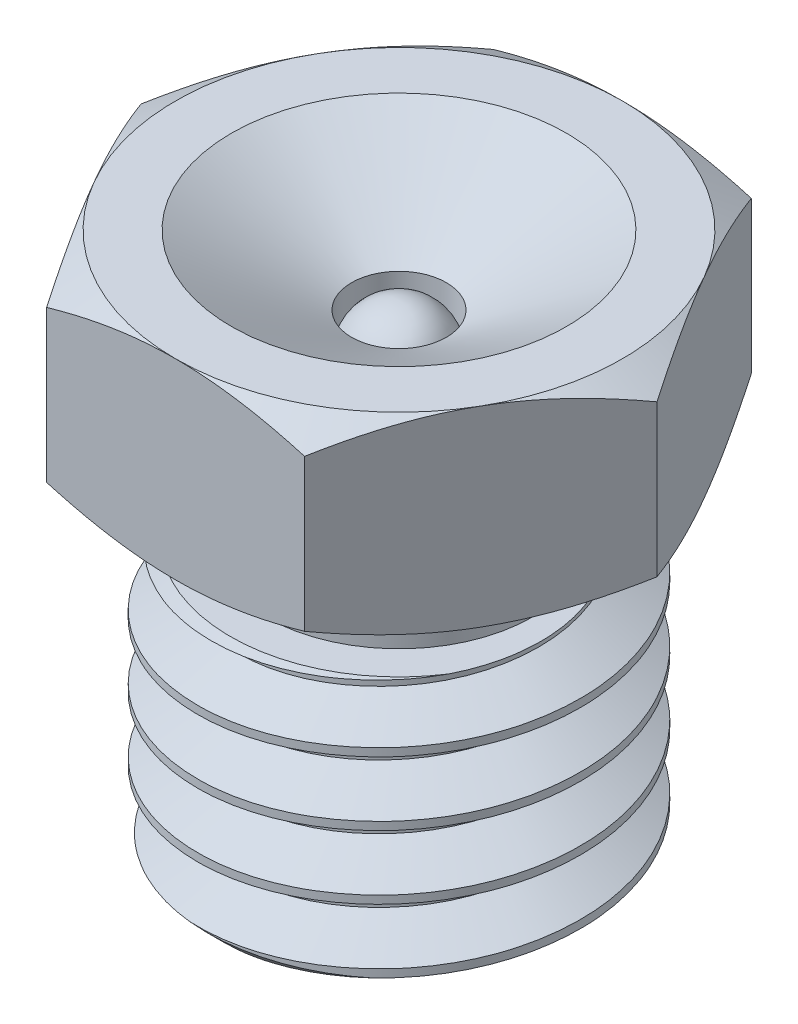
from build123d import *

# Parameters (mm, degrees)
CHAMFER1_SIZE       = 0.36
FILLET1_R           = 0.231
CUT_SWEEP1_PITCH    = 1
BOSS_EXTRUDE1_DEPTH = 3
SKETCH6_OUTSIDE_W   = 21.676
SKETCH6_OUTSIDE_H   = 20.594
SKETCH6_OUTSIDE_R   = 3.5
CUT_EXTRUDE1_DEPTH  = 2.54
CUT_EXTRUDE1_DRAFT  = -60
SKETCH7_OUTSIDE_W   = 21.676
SKETCH7_OUTSIDE_H   = 20.594
SKETCH7_OUTSIDE_R   = 3.5
CUT_EXTRUDE2_DEPTH  = 2.54
CUT_EXTRUDE2_DRAFT  = -60
SKETCH11_R          = 2.1
BOSS_EXTRUDE2_DEPTH = 1.2
SKETCH9_R           = 0.7425
CUT_EXTRUDE4_DEPTH  = 11.468205832


with BuildPart() as part:
    # Sketch2 → Revolve1 (revolve)
    with BuildSketch(Plane.XY, mode=Mode.PRIVATE) as revolve1_sk:
        Polygon((0, 0), (0, -6), (1.65, -6), (1.65, -5.4), (3, -5.4), (3, -1.2), (2.1, -1.2), (2.1, 0), align=None)
    revolve(revolve1_sk.sketch.rotate(Axis((0, 3, 0), (0, -1, 0)), 180), axis=Axis((0, 3, 0), (0, -1, 0)))

    # Chamfer1
    chamfer1_edges = [part.edges().sort_by_distance(p)[0] for p in [
        (3, -5.4, 0),
        (3, -1.2, 0),
    ]]
    chamfer(chamfer1_edges, length=CHAMFER1_SIZE)

    # Fillet1
    fillet1_edges = [part.edges().sort_by_distance(p)[0] for p in [
        (1.65, -6, 0),
        (1.65, -5.4, 0),
    ]]
    fillet(fillet1_edges, radius=FILLET1_R)

    # Cut-Sweep1: the profile of Sketch4 profile screwed along a right-hand helix of 5.2 turns, 8 arcs to a turn; built about Z, then put on its axis
    cut_sweep1_z = Axis((0, 0, 0), (0, 0, 1))
    cut_sweep1_corners = [(3.0003, 0, 0.000173205), (3.0003, 0, -0.875173205), (2.350480947, 0, -0.5), (2.350480947, 0, -0.375)]
    with BuildLine(mode=Mode.PRIVATE) as cut_sweep1_profile:
        Line(cut_sweep1_corners[0], cut_sweep1_corners[1])
        Line(cut_sweep1_corners[1], cut_sweep1_corners[2])
        Line(cut_sweep1_corners[2], cut_sweep1_corners[3])
        Line(cut_sweep1_corners[3], cut_sweep1_corners[0])
    cut_sweep1_cap = Face(cut_sweep1_profile.wire())
    cut_sweep1_turn_angles = [0, 22.5, 45, 67.5, 90, 112.5, 135, 157.5, 180, 202.5, 225, 247.5, 270, 292.5, 315, 337.5, 360]
    cut_sweep1_turn_weights = [1, 0.9238795325112867, 1, 0.9238795325112867, 1, 0.9238795325112867, 1, 0.9238795325112867, 1, 0.9238795325112867, 1, 0.9238795325112867, 1, 0.9238795325112867, 1, 0.9238795325112867, 1]
    cut_sweep1_turn_rails = [Edge.make_bspline([Vector(p[0], p[1], 0).rotate(cut_sweep1_z, cut_sweep1_turn_angles[k]) / cut_sweep1_turn_weights[k] + Vector(0, 0, p[2] + CUT_SWEEP1_PITCH * cut_sweep1_turn_angles[k] / 360) for k in range(17)], [0, 0, 0, 1, 1, 2, 2, 3, 3, 4, 4, 5, 5, 6, 6, 7, 7, 8, 8, 8], 2, cut_sweep1_turn_weights) for p in cut_sweep1_corners]
    cut_sweep1_turn_sides = [Face.make_surface_from_curves(cut_sweep1_turn_rails[p[0]], cut_sweep1_turn_rails[p[1]]) for p in [(0, 1), (1, 2), (2, 3), (3, 0)]]
    cut_sweep1_last_angles = [1800, 1822.5, 1845, 1858.5, 1872]
    cut_sweep1_last_weights = [1, 0.9238795325112867, 1, 0.9723699203976631, 1]
    cut_sweep1_last_rails = [Edge.make_bspline([Vector(p[0], p[1], 0).rotate(cut_sweep1_z, cut_sweep1_last_angles[k]) / cut_sweep1_last_weights[k] + Vector(0, 0, p[2] + CUT_SWEEP1_PITCH * cut_sweep1_last_angles[k] / 360) for k in range(5)], [0, 0, 0, 1, 1, 2, 2, 2], 2, cut_sweep1_last_weights) for p in cut_sweep1_corners]
    cut_sweep1_last_sides = [Face.make_surface_from_curves(cut_sweep1_last_rails[p[0]], cut_sweep1_last_rails[p[1]]) for p in [(0, 1), (1, 2), (2, 3), (3, 0)]]
    cut_sweep1 = Plane(origin=(0, -5.4, 0), x_dir=(-1, 0, 0), z_dir=(0, 1, 0)) * Solid(Shell([*[p.moved(Location((0, 0, CUT_SWEEP1_PITCH * i))) for i in range(5) for p in cut_sweep1_turn_sides], *cut_sweep1_last_sides, cut_sweep1_cap, cut_sweep1_cap.rotate(cut_sweep1_z, 1872).moved(Location((0, 0, CUT_SWEEP1_PITCH * 1872 / 360)))]))
    add(cut_sweep1, mode=Mode.SUBTRACT)

    # Sketch5 → Boss-Extrude1 (add)
    with BuildSketch(Plane(origin=(0, 0, 0), x_dir=(1, 0, 0), z_dir=(0, 1, 0))):
        Polygon((4.041451884, 0), (2.020725942, 3.5), (-2.020725942, 3.5), (-4.041451884, 0), (-2.020725942, -3.5), (2.020725942, -3.5), align=None)
    extrude(amount=BOSS_EXTRUDE1_DEPTH)


with BuildPart() as cut_extrude1_tool:
    # Sketch6 outside → Cut-Extrude1 (with draft: the straight prism first)
    with BuildSketch(Plane.XZ):
        Rectangle(SKETCH6_OUTSIDE_W, SKETCH6_OUTSIDE_H)
        Circle(SKETCH6_OUTSIDE_R, mode=Mode.SUBTRACT)
    extrude(amount=-CUT_EXTRUDE1_DEPTH)
    # Cut-Extrude1: the draft: its side faces are tilted about the plane it starts from
    cut_extrude1_sides = [cut_extrude1_tool.faces().sort_by_distance(p)[0] for p in [
        (0, 1.27, -10.297),
        (10.838, 1.27, 0),
        (0, 1.27, 10.297),
        (-10.838, 1.27, 0),
        (-3.5, 1.27, 0),
    ]]
    draft(cut_extrude1_sides, Plane.XZ, CUT_EXTRUDE1_DRAFT)


with BuildPart() as part_1:
    add(part.part)

    # Cut-Extrude1: cut by cut_extrude1_tool
    add(cut_extrude1_tool.part, mode=Mode.SUBTRACT)


with BuildPart() as cut_extrude2_tool:
    # Sketch7 outside → Cut-Extrude2 (with draft: the straight prism first)
    with BuildSketch(Plane(origin=(0, 3, 0), x_dir=(1, 0, 0), z_dir=(0, 1, 0))):
        Rectangle(SKETCH7_OUTSIDE_W, SKETCH7_OUTSIDE_H)
        Circle(SKETCH7_OUTSIDE_R, mode=Mode.SUBTRACT)
    extrude(amount=-CUT_EXTRUDE2_DEPTH)
    # Cut-Extrude2: the draft: its side faces are tilted about the plane it starts from
    cut_extrude2_sides = [cut_extrude2_tool.faces().sort_by_distance(p)[0] for p in [
        (0, 1.73, 10.297),
        (10.838, 1.73, 0),
        (0, 1.73, -10.297),
        (-10.838, 1.73, 0),
        (-3.5, 1.73, 0),
    ]]
    draft(cut_extrude2_sides, Plane(origin=(0, 3, 0), x_dir=(1, 0, 0), z_dir=(0, 1, 0)), CUT_EXTRUDE2_DRAFT)


with BuildPart() as part_2:
    add(part_1.part)

    # Cut-Extrude2: cut by cut_extrude2_tool
    add(cut_extrude2_tool.part, mode=Mode.SUBTRACT)

    # Sketch11 → Boss-Extrude2 (add)
    with BuildSketch(Plane.XZ):
        with Locations(Location((0, 0, 0), (0, 0, 180))):
            Circle(SKETCH11_R)
    extrude(amount=BOSS_EXTRUDE2_DEPTH)

    # Cut-Extrude3 cone 1 section (through the dimple's axis) → Cut-Extrude3 (revolve, cut)
    with BuildSketch(Plane(origin=(0, 3, 0), x_dir=(0, 0, 1), z_dir=(1, 0, 0))):
        Polygon((0, 0), (2.625, 0), (0, 1.515544457), align=None)
    revolve(axis=Axis((0, 3, 0), (0, -1, 0)), mode=Mode.SUBTRACT)

    # Sketch9 → Cut-Extrude4 (cut, through all)
    with BuildSketch(Plane.XZ.offset(6)):
        Circle(SKETCH9_R)
    extrude(amount=-CUT_EXTRUDE4_DEPTH, mode=Mode.SUBTRACT)


with BuildPart() as body_2:
    # Sketch10 → Revolve2 (revolve)
    with BuildSketch(Plane.XY):
        with BuildLine():
            Line((0, 2.040138118), (0, 0.555138118))
            ThreePointArc((0, 0.555138118), (0.7425, 1.297638118), (0, 2.040138118))
        make_face()
    revolve(axis=Axis((0, 3, 0), (0, -1, 0)))


solid = Compound([part_2.part, body_2.part])
